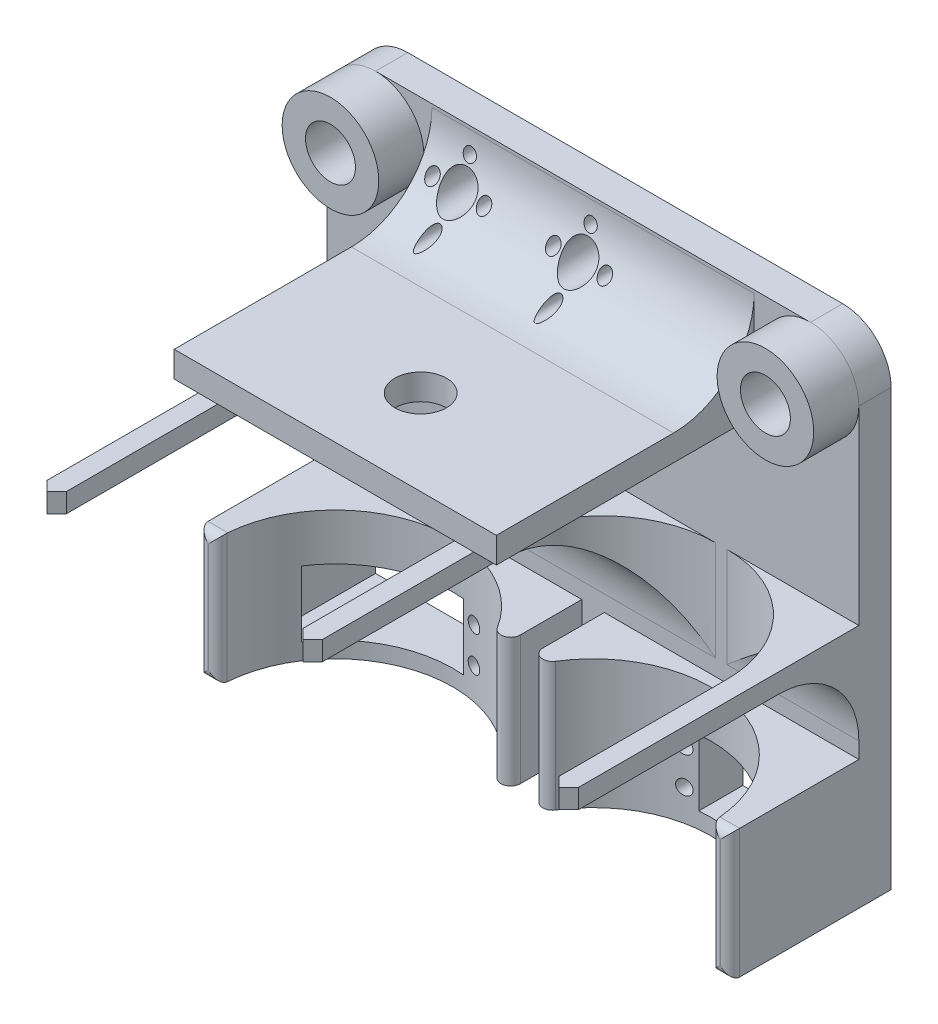
from build123d import *

# Parameters (mm, degrees)
ESQUISSE1_W             = 165
ESQUISSE1_H             = 150
BOSS_EXTRU_1_DEPTH      = 10
ESQUISSE2_R             = 7.75
ENL_V_MAT_EXTRU_1_DEPTH = 10
BOSS_EXTRU_2_START      = -24
ESQUISSE3_R             = 15
ESQUISSE3_R_2           = 7.75
BOSS_EXTRU_2_DEPTH      = 24
CONG_1_R                = 15
ESQUISSE4_R             = 5.25
ESQUISSE4_R_2           = 2
ENL_V_MAT_EXTRU_2_DEPTH = 28
BOSS_EXTRU_3_DEPTH      = 40
ESQUISSE5_R             = 2.25
ESQUISSE5_W             = 41
ESQUISSE5_H             = 20.5
ENL_V_MAT_EXTRU_3_DEPTH = 30
ESQUISSE8_W             = 100
ESQUISSE8_H             = 8
BOSS_EXTRU_4_DEPTH      = 80
ESQUISSE9_W             = 6
ESQUISSE9_H             = 6
BOSS_EXTRU_5_DEPTH      = 90
CONG_2_R                = 35
ESQUISSE10_R            = 8
ENL_V_MAT_EXTRU_5_DEPTH = 35
CHANFREIN1_SIZE         = 3
CONG_3_R                = 25
CONG_4_R                = 25
CONG_5_R                = 3


# Some blends are built 0.0001 mm under size
with BuildPart() as part:
    # Esquisse1 → Boss.-Extru.1 (new body)
    with BuildSketch(Plane.XY):
        Rectangle(ESQUISSE1_W, ESQUISSE1_H)
    extrude(amount=BOSS_EXTRU_1_DEPTH)

    # Esquisse2 → Enlèv. mat.-Extru.1 (cut)
    with BuildSketch(Plane.XY.offset(10)):
        with Locations((-67.5, 60)):
            Circle(ESQUISSE2_R)
        with Locations(Location((67.5, 60, 0), (0, 0, 180))):
            Circle(ESQUISSE2_R)
    extrude(amount=-ENL_V_MAT_EXTRU_1_DEPTH, mode=Mode.SUBTRACT)

    # Esquisse3 → Boss.-Extru.2 (add)
    # profile 1 of 2: a face of its own
    with BuildSketch(Plane(origin=(0, 0, 0), x_dir=(-1, 0, 0), z_dir=(0, 0, -1)).offset(BOSS_EXTRU_2_START)):
        with Locations((-67.5, 60)):
            Circle(ESQUISSE3_R)
        with Locations((-67.5, 60)):
            Circle(ESQUISSE3_R_2, mode=Mode.SUBTRACT)
    # profile 2 of 2: a face of its own
    with BuildSketch(Plane(origin=(0, 0, 0), x_dir=(-1, 0, 0), z_dir=(0, 0, -1)).offset(BOSS_EXTRU_2_START)):
        with Locations((67.5, 60)):
            Circle(ESQUISSE3_R)
        with Locations(Location((67.5, 60, 0), (0, 0, 180))):
            Circle(ESQUISSE3_R_2, mode=Mode.SUBTRACT)
    extrude(amount=BOSS_EXTRU_2_DEPTH)

    # Congé1
    cong_1_edges = [part.edges().sort_by_distance(p)[0] for p in [
        (82.5, 75, 5),
        (-82.5, 75, 5),
    ]]
    fillet(cong_1_edges, radius=CONG_1_R)

    # Esquisse4 → Enlèv. mat.-Extru.2 (cut)
    with BuildSketch(Plane(origin=(0, 0, 0), x_dir=(-1, 0, 0), z_dir=(0, 0, -1))):
        with Locations((37.5, 60)):
            Circle(ESQUISSE4_R)
        with Locations((29.5, 60)):
            Circle(ESQUISSE4_R_2)
        with Locations((37.5, 68)):
            Circle(ESQUISSE4_R_2)
        with Locations((45.5, 60)):
            Circle(ESQUISSE4_R_2)
        with Locations((37.5, 52)):
            Circle(ESQUISSE4_R_2)
        with Locations((0, 52)):
            Circle(ESQUISSE4_R_2)
        with Locations((8, 60)):
            Circle(ESQUISSE4_R_2)
        with Locations((0, 68)):
            Circle(ESQUISSE4_R_2)
        with Locations((-8, 60)):
            Circle(ESQUISSE4_R_2)
        with Locations((0, 60)):
            Circle(ESQUISSE4_R)
    extrude(amount=-ENL_V_MAT_EXTRU_2_DEPTH, mode=Mode.SUBTRACT)

    # Esquisse6 → Boss.-Extru.3 (add)
    with BuildSketch(Plane.XZ.offset(75)):
        with BuildLine():
            Line((-76.5, 10), (-3.5, 10))
            Line((-3.5, 10), (-3.5, 50))
            ThreePointArc((-3.5, 50), (-40, 13.5), (-76.5, 50))
            Line((-76.5, 50), (-82.5, 50))
            Line((-82.5, 50), (-82.5, 10))
            Line((-82.5, 10), (-76.5, 10))
        make_face()
        with BuildLine():
            Line((3.5, 10), (3.5, 50))
            ThreePointArc((3.5, 50), (40, 13.5), (76.5, 50))
            Line((76.5, 50), (82.5, 50))
            Line((82.5, 50), (82.5, 10))
            Line((82.5, 10), (76.5, 10))
            Line((76.5, 10), (3.5, 10))
        make_face()
    extrude(amount=-BOSS_EXTRU_3_DEPTH)

    # Esquisse5 → Enlèv. mat.-Extru.3 (cut)
    with BuildSketch(Plane(origin=(0, 0, 0), x_dir=(-1, 0, 0), z_dir=(0, 0, -1))):
        with Locations((-32.65, -54.25)):
            Circle(ESQUISSE5_R)
        with Locations((-32.65, -65.25)):
            Circle(ESQUISSE5_R)
        with Locations((32.65, -65.25)):
            Circle(ESQUISSE5_R)
        with Locations((32.65, -54.25)):
            Circle(ESQUISSE5_R)
        with Locations((-57, -59.75)):
            Rectangle(ESQUISSE5_W, ESQUISSE5_H)
        with Locations((57, -59.75)):
            Rectangle(ESQUISSE5_W, ESQUISSE5_H)
    extrude(amount=-ENL_V_MAT_EXTRU_3_DEPTH, mode=Mode.SUBTRACT)

    # Esquisse8 → Boss.-Extru.4 (add)
    with BuildSketch(Plane.XY.offset(10)):
        with Locations((0, 45)):
            Rectangle(ESQUISSE8_W, ESQUISSE8_H)
    extrude(amount=BOSS_EXTRU_4_DEPTH)

    # Esquisse9 → Boss.-Extru.5 (add)
    with BuildSketch(Plane.XY.offset(10)):
        with Locations((-79.5, -2)):
            Rectangle(ESQUISSE9_W, ESQUISSE9_H)
        with Locations((79.5, -2)):
            Rectangle(ESQUISSE9_W, ESQUISSE9_H)
        with Locations((0, -2)):
            Rectangle(ESQUISSE9_W, ESQUISSE9_H)
    extrude(amount=BOSS_EXTRU_5_DEPTH)

    # Congé2
    cong_2_edges = [part.edges().sort_by_distance(p)[0] for p in [
        (-76.5, -2, 10),
        (76.5, -2, 10),
        (-3, -2, 10),
        (3, -2, 10),
    ]]
    fillet(cong_2_edges, radius=CONG_2_R)

    # Esquisse10 → Enlèv. mat.-Extru.5 (cut)
    with BuildSketch(Plane(origin=(0, 49, 0), x_dir=(1, 0, 0), z_dir=(0, 1, 0))):
        with Locations(Location((0, -63.5, 0), (0, 0, 270))):
            Circle(ESQUISSE10_R)
    extrude(amount=-ENL_V_MAT_EXTRU_5_DEPTH, mode=Mode.SUBTRACT)

    # Chanfrein1
    chanfrein1_edges = [part.edges().sort_by_distance(p)[0] for p in [
        (76.5, -2, 100),
        (82.5, -2, 100),
        (-3, -2, 100),
        (3, -2, 100),
        (-82.5, -2, 100),
        (-76.5, -2, 100),
    ]]
    chamfer(chanfrein1_edges, length=CHANFREIN1_SIZE - 0.0001)  # a hair under: the kernel refuses the full size

    # Congé3
    cong_3_edges = [part.edges().sort_by_distance(p)[0] for p in [
        (-62, -5, 10),
        (62, -5, 10),
        (0, -5, 10),
    ]]
    fillet(cong_3_edges, radius=CONG_3_R)

    # Congé4
    # the kernel refuses this fillet: 25 mm, written as the material it adds along each edge
    with BuildSketch(Plane(origin=(50, 49, 10), x_dir=(0, 1, 0), z_dir=(-1, 0, 0))) as cong_4_piece_1_section:
        with BuildLine():
            CenterArc((CONG_4_R, -CONG_4_R), CONG_4_R, 90, 90)
            Line((0, -CONG_4_R), (0, 0))
            Line((0, 0), (CONG_4_R, 0))
        make_face()
    cong_4_piece_1 = extrude(amount=100, mode=Mode.PRIVATE)
    cong_4_piece_1 = cong_4_piece_1 - Plane(origin=(-37.5, 52, 15.912326825), x_dir=(-1, 0, 0), z_dir=(0, 0, -1)) * Cylinder(2, 300, mode=Mode.PRIVATE)
    cong_4_piece_1 = cong_4_piece_1 - Plane(origin=(-45.5, 60, 15.912326825), x_dir=(-1, 0, 0), z_dir=(0, 0, -1)) * Cylinder(2, 300, mode=Mode.PRIVATE)
    cong_4_piece_1 = cong_4_piece_1 - Plane(origin=(-37.5, 60, 15.912326825), x_dir=(-1, 0, 0), z_dir=(0, 0, -1)) * Cylinder(5.25, 300, mode=Mode.PRIVATE)
    cong_4_piece_1 = cong_4_piece_1 - Plane(origin=(-29.5, 60, 15.912326825), x_dir=(-1, 0, 0), z_dir=(0, 0, -1)) * Cylinder(2, 300, mode=Mode.PRIVATE)
    cong_4_piece_1 = cong_4_piece_1 - Plane(origin=(-37.5, 68, 15.912326825), x_dir=(-1, 0, 0), z_dir=(0, 0, -1)) * Cylinder(2, 300, mode=Mode.PRIVATE)
    cong_4_piece_1 = cong_4_piece_1 - Plane(origin=(0, 52, 15.912326825), x_dir=(-1, 0, 0), z_dir=(0, 0, -1)) * Cylinder(2, 300, mode=Mode.PRIVATE)
    cong_4_piece_1 = cong_4_piece_1 - Plane(origin=(-8, 60, 15.912326825), x_dir=(-1, 0, 0), z_dir=(0, 0, -1)) * Cylinder(2, 300, mode=Mode.PRIVATE)
    cong_4_piece_1 = cong_4_piece_1 - Plane(origin=(0, 60, 15.912326825), x_dir=(-1, 0, 0), z_dir=(0, 0, -1)) * Cylinder(5.25, 300, mode=Mode.PRIVATE)
    cong_4_piece_1 = cong_4_piece_1 - Plane(origin=(0, 68, 15.912326825), x_dir=(-1, 0, 0), z_dir=(0, 0, -1)) * Cylinder(2, 300, mode=Mode.PRIVATE)
    cong_4_piece_1 = cong_4_piece_1 - Plane(origin=(8, 60, 15.912326825), x_dir=(-1, 0, 0), z_dir=(0, 0, -1)) * Cylinder(2, 300, mode=Mode.PRIVATE)
    add(cong_4_piece_1)

    # Congé5
    cong_5_edges = [part.edges().sort_by_distance(p)[0] for p in [
        (-76.5, -55, 50),
        (-3.5, -55, 50),
        (-79.5, -35, 50),
        (-82.5, -55, 50),
        (-79.5, -75, 50),
        (3.5, -55, 50),
        (79.5, -35, 50),
        (76.5, -55, 50),
        (82.5, -55, 50),
        (79.5, -75, 50),
    ]]
    fillet(cong_5_edges, radius=CONG_5_R)


solid = part.part
